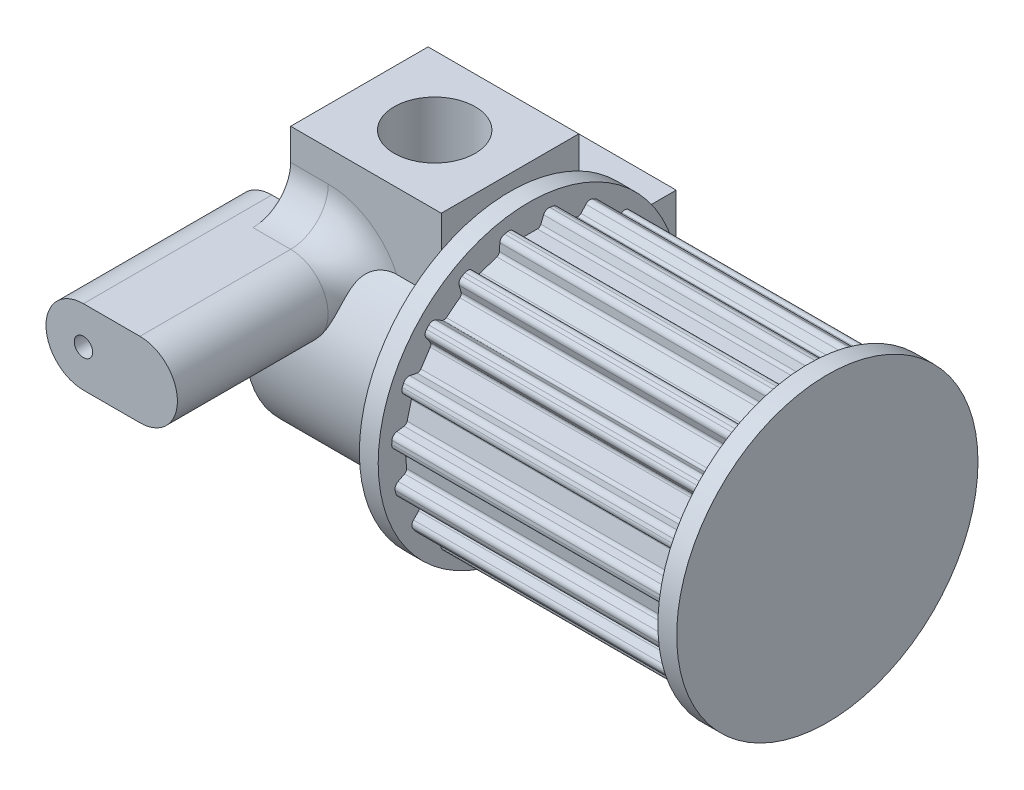
from build123d import *

# Parameters (mm, degrees)
SKETCH1_R           = 1.75
BOSS_EXTRUDE1_DEPTH = 4
SKETCH2_R           = 2.15
CUT_EXTRUDE1_DEPTH  = 5
SKETCH7_R           = 7.3
SKETCH7_R_2         = 1.75
BOSS_EXTRUDE5_DEPTH = 15.85
CUT_EXTRUDE3_START  = -15.85
CUT_EXTRUDE3_DEPTH  = 15.85
CIRPATTERN1_COUNT   = 19
SKETCH9_R           = 8
BOSS_EXTRUDE6_DEPTH = 1
SKETCH10_R          = 8
BOSS_EXTRUDE7_DEPTH = 1
SKETCH3_R           = 2.15
CUT_EXTRUDE2_DEPTH  = 5
BOSS_EXTRUDE2_START = 4
SKETCH4_W           = 8
SKETCH4_H           = 7.3
SKETCH4_R           = 2.15
BOSS_EXTRUDE2_DEPTH = 4
BOSS_EXTRUDE3_START = 4
SKETCH5_W           = 8
SKETCH5_H           = 7.3
SKETCH5_R           = 2.15
BOSS_EXTRUDE3_DEPTH = 4
SKETCH6_R           = 0.4895
BOSS_EXTRUDE4_DEPTH = 10
FILLET1_R           = 2


with BuildPart() as part:
    # Sketch1 → Boss-Extrude1 (new, symmetric)
    with BuildSketch(Plane(origin=(0, 0, 0), x_dir=(0, 0, -1), z_dir=(1, 0, 0))):
        with BuildLine():
            Line((-3.65, 4.824935233), (3.65, 4.824935233))
            ThreePointArc((3.65, 4.824935233), (4.277996026, 4.277996026), (4.824935233, 3.65))
            Line((4.824935233, 3.65), (4.824935233, -3.65))
            ThreePointArc((4.824935233, -3.65), (-4.277996026, -4.277996026), (-3.65, 4.824935233))
        make_face()
        Circle(SKETCH1_R, mode=Mode.SUBTRACT)
    extrude(amount=BOSS_EXTRUDE1_DEPTH, both=True)

    # Sketch2 → Cut-Extrude1 (cut)
    with BuildSketch(Plane(origin=(0, 4.824935233, 0), x_dir=(1, 0, 0), z_dir=(0, 1, 0))):
        with Locations(Location((0, 0, 0), (0, 0, 270))):
            Circle(SKETCH2_R)
    extrude(amount=-CUT_EXTRUDE1_DEPTH, mode=Mode.SUBTRACT)

    # Sketch7 → Boss-Extrude5 (add)
    with BuildSketch(Plane(origin=(4, 0, 0), x_dir=(0, 0, -1), z_dir=(1, 0, 0))):
        Circle(SKETCH7_R)
        Circle(SKETCH7_R_2, mode=Mode.SUBTRACT)
    extrude(amount=BOSS_EXTRUDE5_DEPTH)

    # Sketch8 → Cut-Extrude3 (cut)
    with BuildSketch(Plane(origin=(19.85, 0, 0), x_dir=(0, 0, -1), z_dir=(1, 0, 0)).offset(CUT_EXTRUDE3_START)):
        with BuildLine():
            Line((-0.454130838, 6.549894534), (0.452760329, 6.549894534))
            ThreePointArc((0.452760329, 6.549894534), (0.563806886, 6.583637432), (0.637417439, 6.673367066))
            Line((0.637417439, 6.673367066), (0.786506247, 7.03329929))
            ThreePointArc((0.786506247, 7.03329929), (0.916480179, 7.180062711), (1.1093452, 7.215216783))
            ThreePointArc((1.1093452, 7.215216783), (-0.000740572, 7.299999962), (-1.110809118, 7.214991553))
            ThreePointArc((-1.110809118, 7.214991553), (-0.918007937, 7.179916572), (-0.787995556, 7.033290073))
            Line((-0.787995556, 7.033290073), (-0.638906747, 6.673357849))
            ThreePointArc((-0.638906747, 6.673357849), (-0.565244886, 6.583600612), (-0.454130838, 6.549894534))
        make_face()
    cut_extrude3 = extrude(amount=CUT_EXTRUDE3_DEPTH, mode=Mode.SUBTRACT)

    # CirPattern1: Cut-Extrude3 ×19 about axis
    cirpattern1_axis = Axis((0, 0, 0), (1, 0, 0))
    for i in range(1, CIRPATTERN1_COUNT):
        add(cut_extrude3.rotate(cirpattern1_axis, i * 360 / CIRPATTERN1_COUNT), mode=Mode.SUBTRACT)

    # Sketch9 → Boss-Extrude6 (add)
    with BuildSketch(Plane(origin=(19.85, 0, 0), x_dir=(0, 0, -1), z_dir=(1, 0, 0))):
        Circle(SKETCH9_R)
    extrude(amount=BOSS_EXTRUDE6_DEPTH)

    # Sketch10 → Boss-Extrude7 (add)
    with BuildSketch(Plane.ZY.offset(-4)):
        with Locations(Location((0, 0, 0), (0, 0, 180))):
            Circle(SKETCH10_R)
    extrude(amount=-BOSS_EXTRUDE7_DEPTH)

    # Sketch3 → Cut-Extrude2 (cut)
    with BuildSketch(Plane(origin=(0, 0, -4.824935233), x_dir=(-1, 0, 0), z_dir=(0, 0, -1))):
        Circle(SKETCH3_R)
    extrude(amount=-CUT_EXTRUDE2_DEPTH, mode=Mode.SUBTRACT)

    # Sketch4 → Boss-Extrude2 (add)
    with BuildSketch(Plane(origin=(0, 4.824935233, 0), x_dir=(1, 0, 0), z_dir=(0, 1, 0)).offset(BOSS_EXTRUDE2_START)):
        Rectangle(SKETCH4_W, SKETCH4_H)
        with Locations(Location((0, 0, 0), (0, 0, 270))):
            Circle(SKETCH4_R, mode=Mode.SUBTRACT)
    extrude(amount=-BOSS_EXTRUDE2_DEPTH)

    # Sketch5 → Boss-Extrude3 (add)
    with BuildSketch(Plane(origin=(0, 0, -4.824935233), x_dir=(-1, 0, 0), z_dir=(0, 0, -1)).offset(BOSS_EXTRUDE3_START)):
        Rectangle(SKETCH5_W, SKETCH5_H)
        Circle(SKETCH5_R, mode=Mode.SUBTRACT)
    extrude(amount=-BOSS_EXTRUDE3_DEPTH)

    # Sketch6 → Boss-Extrude4 (add)
    with BuildSketch(Plane.XY.offset(3.65)):
        with BuildLine():
            Line((-2, 5.1645), (-5, 5.1645))
            ThreePointArc((-5, 5.1645), (-6.9895, 3.175), (-5, 1.1855))
            Line((-5, 1.1855), (-2, 1.1855))
            ThreePointArc((-2, 1.1855), (-0.0105, 3.175), (-2, 5.1645))
        make_face()
        with Locations((-5, 3.175)):
            Circle(SKETCH6_R, mode=Mode.SUBTRACT)
    extrude(amount=BOSS_EXTRUDE4_DEPTH)

    # Fillet1
    # the kernel refuses this fillet: 2 mm, written as the material it adds along each edge
    with BuildSketch(Plane(origin=(-2, 3.175, 3.65), x_dir=(0.03534330894551541, -0.9993752300876693, 0), z_dir=(-0.9993752300876693, -0.03534330894551541, 0))) as fillet1_piece_1:
        with BuildLine():
            CenterArc((1.9895 + FILLET1_R, FILLET1_R), FILLET1_R, 180, 90)
            Line((1.9895, FILLET1_R), (1.9895, 0))
            Line((1.9895, 0), (1.9895 + FILLET1_R, 0))
        make_face()
    revolve(axis=Axis((-2, 3.175, 3.65), (0, 0, 1)), revolution_arc=177.974555734)
    with BuildSketch(Plane(origin=(-2, 5.1645, 3.65), x_dir=(0, 1, 0), z_dir=(-1, 0, 0))) as fillet1_piece_2:
        with BuildLine():
            CenterArc((FILLET1_R, -FILLET1_R), FILLET1_R, 90, 90)
            Line((0, -FILLET1_R), (0, 0))
            Line((0, 0), (FILLET1_R, 0))
        make_face()
    extrude(amount=2)


solid = part.part
